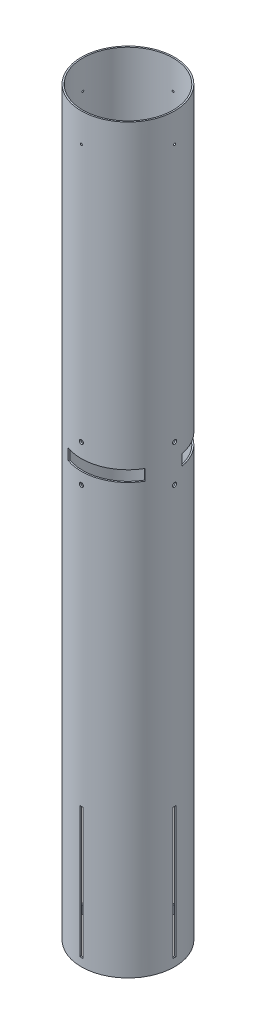
from build123d import *

# Parameters (mm, degrees)
SKETCH1_R              = 51.1048
SKETCH1_R_2            = 49.53
BOSS_EXTRUDE1_DEPTH    = 812.8
CUT_EXTRUDE1_DEPTH     = 817.00688794
CIRPATTERN1_COUNT      = 4
CUT_EXTRUDE2_DEPTH     = 817.00688794
CIRPATTERN2_COUNT      = 4
SKETCH3_R              = 3.175
CUT_EXTRUDE3_DEPTH     = 817.006888053
CUT_EXTRUDE4_START     = 470.535
CUT_EXTRUDE4_DEPTH     = 12.065
CIRPATTERN3_COUNT      = 3
LPATTERN1_COPY_1_DEPTH = 817.00688794
LPATTERN1_COPY_2_DEPTH = 817.00688794
LPATTERN1_COPY_3_DEPTH = 817.00688794
LPATTERN1_COPY_4_DEPTH = 817.00688794
SKETCH8_R              = 1.0922
CUT_EXTRUDE5_DEPTH     = 817.006888053
CIRPATTERN4_COUNT      = 4
SKETCH18_W             = 6.54812
SKETCH18_H             = 51.1048


with BuildPart() as part:
    # Sketch1 → Boss-Extrude1 (new body)
    with BuildSketch(Plane(origin=(0, 0, 0), x_dir=(1, 0, 0), z_dir=(0, 1, 0))):
        Circle(SKETCH1_R)
        Circle(SKETCH1_R_2, mode=Mode.SUBTRACT)
    extrude(amount=BOSS_EXTRUDE1_DEPTH)

    # Sketch2 → Cut-Extrude1 (cut, through all)
    with BuildSketch(Plane(origin=(0, 0, 0), x_dir=(0, 0, -1), z_dir=(1, 0, 0))):
        Polygon((0, 8.89), (1.5875, 8.89), (1.5875, 152.4), (-1.5875, 152.4), (-1.5875, 8.89), align=None)
    cut_extrude1 = extrude(amount=-CUT_EXTRUDE1_DEPTH, mode=Mode.SUBTRACT)

    # CirPattern1: Cut-Extrude1 ×4 about axis
    cirpattern1_axis = Axis((0, 0, 0), (0, 1, 0))
    for i in range(1, CIRPATTERN1_COUNT):
        add(cut_extrude1.rotate(cirpattern1_axis, i * 360 / CIRPATTERN1_COUNT), mode=Mode.SUBTRACT)

    # Sketch2<3> → Cut-Extrude2 (cut, through all)
    with BuildSketch(Plane(origin=(0, 0, 0), x_dir=(0, 0, -1), z_dir=(1, 0, 0))):
        with BuildLine():
            ThreePointArc((0, 500.724999945), (-1.590990219, 496.884009781), (2.249999945, 498.475))
            ThreePointArc((2.249999945, 498.475), (1.590990219, 500.065990219), (0, 500.724999945))
        make_face()
    cut_extrude2 = extrude(amount=-CUT_EXTRUDE2_DEPTH, mode=Mode.SUBTRACT)

    # CirPattern2: Cut-Extrude2 ×4 about axis
    cirpattern2_axis = Axis((0, 812.8, 0), (0, -1, 0))
    for i in range(1, CIRPATTERN2_COUNT):
        add(cut_extrude2.rotate(cirpattern2_axis, i * 360 / CIRPATTERN2_COUNT), mode=Mode.SUBTRACT)

    # Sketch3 → Cut-Extrude3 (cut, through all)
    with BuildSketch(Plane(origin=(0, 0, 0), x_dir=(0.7071067811865477, 0, -0.7071067811865475), z_dir=(0.7071067811865475, 0, 0.7071067811865477))):
        with Locations((0, 127)):
            Circle(SKETCH3_R)
    extrude(amount=-CUT_EXTRUDE3_DEPTH, mode=Mode.SUBTRACT)

    # Sketch7 → Cut-Extrude4 (cut)
    with BuildSketch(Plane(origin=(0, 0, 0), x_dir=(1, 0, 0), z_dir=(0, 1, 0)).offset(CUT_EXTRUDE4_START)):
        with BuildLine():
            Line((-44.258055055, -25.5524), (-42.894238249, -24.765))
            ThreePointArc((-42.894238249, -24.765), (-48.777528007, 8.60079424), (-31.837270308, 37.942181268))
            Line((-31.837270308, 37.942181268), (-32.849532236, 39.148548057))
            ThreePointArc((-32.849532236, 39.148548057), (-45.829888074, 22.612428931), (-51.055245404, 2.249999945))
            ThreePointArc((-51.055245404, 2.249999945), (-51.1048, 0), (-51.055245404, -2.249999945))
            ThreePointArc((-51.055245404, -2.249999945), (-49.060236172, -14.310618779), (-44.258055055, -25.5524))
        make_face()
    cut_extrude4 = extrude(amount=CUT_EXTRUDE4_DEPTH, mode=Mode.SUBTRACT)

    # CirPattern3: Cut-Extrude4 ×3 about axis
    cirpattern3_axis = Axis((0, 812.8, 0), (0, -1, 0))
    for i in range(1, CIRPATTERN3_COUNT):
        add(cut_extrude4.rotate(cirpattern3_axis, i * 360 / CIRPATTERN3_COUNT), mode=Mode.SUBTRACT)

    # LPattern1 copy 1 sketch → LPattern1 copy 1 (cut, through all)
    with BuildSketch(Plane(origin=(0, -40.7416, 0), x_dir=(1, 0, 0), z_dir=(0, 0, 1))):
        with BuildLine():
            ThreePointArc((0, 500.724999945), (-1.590990219, 496.884009781), (2.249999945, 498.475))
            ThreePointArc((2.249999945, 498.475), (1.590990219, 500.065990219), (0, 500.724999945))
        make_face()
    extrude(amount=-LPATTERN1_COPY_1_DEPTH, mode=Mode.SUBTRACT)

    # LPattern1 copy 2 sketch → LPattern1 copy 2 (cut, through all)
    with BuildSketch(Plane(origin=(0, -40.7416, 0), x_dir=(0, 0, 1), z_dir=(-1, 0, 0))):
        with BuildLine():
            ThreePointArc((0, 500.724999945), (-1.590990219, 496.884009781), (2.249999945, 498.475))
            ThreePointArc((2.249999945, 498.475), (1.590990219, 500.065990219), (0, 500.724999945))
        make_face()
    extrude(amount=-LPATTERN1_COPY_2_DEPTH, mode=Mode.SUBTRACT)

    # LPattern1 copy 3 sketch → LPattern1 copy 3 (cut, through all)
    with BuildSketch(Plane(origin=(0, -40.7416, 0), x_dir=(-1, 0, 0), z_dir=(0, 0, -1))):
        with BuildLine():
            ThreePointArc((0, 500.724999945), (-1.590990219, 496.884009781), (2.249999945, 498.475))
            ThreePointArc((2.249999945, 498.475), (1.590990219, 500.065990219), (0, 500.724999945))
        make_face()
    extrude(amount=-LPATTERN1_COPY_3_DEPTH, mode=Mode.SUBTRACT)

    # LPattern1 copy 4 sketch → LPattern1 copy 4 (cut, through all)
    with BuildSketch(Plane(origin=(0, -40.7416, 0), x_dir=(0, 0, -1), z_dir=(1, 0, 0))):
        with BuildLine():
            ThreePointArc((0, 500.724999945), (-1.590990219, 496.884009781), (2.249999945, 498.475))
            ThreePointArc((2.249999945, 498.475), (1.590990219, 500.065990219), (0, 500.724999945))
        make_face()
    extrude(amount=-LPATTERN1_COPY_4_DEPTH, mode=Mode.SUBTRACT)

    # Sketch8 → Cut-Extrude5 (cut, through all)
    with BuildSketch(Plane.XY):
        with Locations((0, 781.05)):
            Circle(SKETCH8_R)
    cut_extrude5 = extrude(amount=-CUT_EXTRUDE5_DEPTH, mode=Mode.SUBTRACT)

    # CirPattern4: Cut-Extrude5 ×4 about axis
    cirpattern4_axis = Axis((0, 812.8, 0), (0, -1, 0))
    for i in range(1, CIRPATTERN4_COUNT):
        add(cut_extrude5.rotate(cirpattern4_axis, i * 360 / CIRPATTERN4_COUNT), mode=Mode.SUBTRACT)

    # Sketch18 → 1/2 Clearance Hole4 (revolve, cut)
    with BuildSketch(Plane(origin=(0, 752.856, 0), x_dir=(0, -1, 0), z_dir=(1, 0, 0))):
        with Locations((3.27406, 25.5524)):
            Rectangle(SKETCH18_W, SKETCH18_H)
    revolve(axis=Axis((0, 752.856, 6.35), (0, 0, -1)), mode=Mode.SUBTRACT)


solid = part.part
